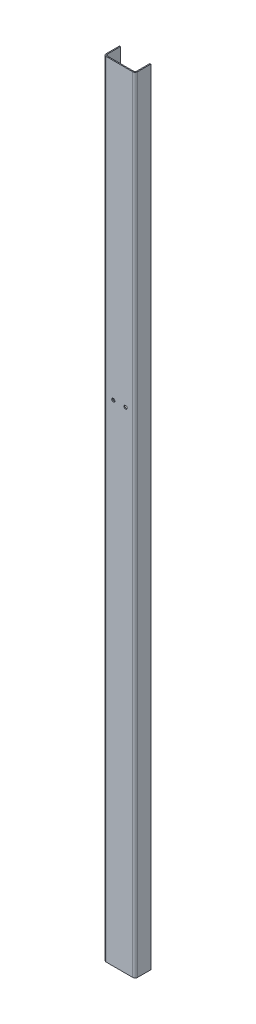
from build123d import *

# Parameters (mm, degrees)
SM_BASE_FLANGE_1_DEPTH      = 800
HOLE_WIZARD_5_5_5_5_1_D     = 5.5
HOLE_WIZARD_5_5_5_5_1_DEPTH = 2
HOLE_WIZARD_6_5_6_5_1_D     = 6.5


# Sheet-metal steps are written as plain solids
with BuildPart() as part:
    # Sketch 1 → 基体-法兰1 (new, symmetric)
    with BuildSketch(Plane(origin=(0, 0, 0), x_dir=(1, 0, 0), z_dir=(0, 1, 0))):
        with BuildLine():
            Line((-30, 30), (-30, 3))
            ThreePointArc((-30, 3), (-29.121320344, 0.878679656), (-27, 0))
            Line((-27, 0), (27, 0))
            ThreePointArc((27, 0), (29.121320344, 0.878679656), (30, 3))
            Line((30, 3), (30, 30))
            Line((30, 30), (32, 30))
            Line((32, 30), (32, 3))
            ThreePointArc((32, 3), (30.535533906, -0.535533906), (27, -2))
            Line((27, -2), (-27, -2))
            ThreePointArc((-27, -2), (-30.535533906, -0.535533906), (-32, 3))
            Line((-32, 3), (-32, 30))
            Line((-32, 30), (-30, 30))
        make_face()
    extrude(amount=SM_BASE_FLANGE_1_DEPTH, both=True)

    # Ø5.5 (5.5) 直径孔1
    with Locations(Plane(origin=(-32, 700, -15), x_dir=(0, 0, -1), z_dir=(-1, 0, 0))):
        with Locations((0, 0), (0, 350), (0, 700), (0, 1050), (0, 1400)):
            Hole(HOLE_WIZARD_5_5_5_5_1_D / 2, depth=HOLE_WIZARD_5_5_5_5_1_DEPTH)

    # Ø6.5 (6.5) 直径孔1 (through all)
    with Locations(Plane(origin=(-12.5, 200, 0), x_dir=(-1, 0, 0), z_dir=(0, 0, -1))):
        with Locations((0, 0), (-25, 0)):
            Hole(HOLE_WIZARD_6_5_6_5_1_D / 2)


solid = part.part
